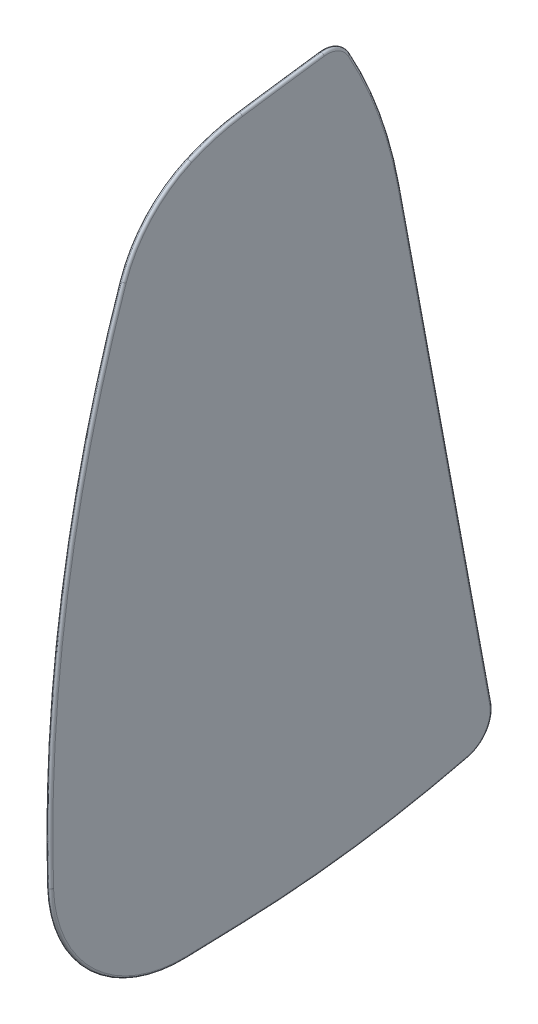
from build123d import *

# Parameters (mm, degrees)
BOSS_EXTRUDE1_DEPTH = 1.5875
FILLET1_R           = 0.79375


with BuildPart() as part:
    # Sketch1 → Boss-Extrude1 (new body)
    with BuildSketch(Plane(origin=(0, 0, 0), x_dir=(0, 0, -1), z_dir=(1, 0, 0))):
        with BuildLine():
            Line((-17.902635187, -0.569374423), (0, 0))
            ThreePointArc((0, 0), (37.12605167, 3.135689948), (73.719447715, 10.142802762))
            ThreePointArc((73.719447715, 10.142802762), (79.921895168, 14.569472776), (81.394996501, 22.045817758))
            Line((81.394996501, 22.045817758), (51.482359978, 183.08555927))
            ThreePointArc((51.482359978, 183.08555927), (45.228157216, 206.171293063), (35.33630552, 227.947826924))
            ThreePointArc((35.33630552, 227.947826924), (31.668987667, 231.46398016), (26.65826502, 232.303749395))
            ThreePointArc((26.65826502, 232.303749395), (13.324550439, 230.484854806), (0, 228.6))
            ThreePointArc((0, 228.6), (-8.544073084, 226.765963851), (-16.757921757, 223.783085471))
            ThreePointArc((-16.757921757, 223.783085471), (-30.073107103, 214.214239464), (-38.432839733, 200.108501446))
            ThreePointArc((-38.432839733, 200.108501446), (-57.504393579, 121.571137315), (-62.136879452, 40.884200297))
            ThreePointArc((-62.136879452, 40.884200297), (-48.597224699, 11.004576546), (-17.902635187, -0.569374423))
        make_face()
    extrude(amount=BOSS_EXTRUDE1_DEPTH)

    # Fillet1
    fillet1_edges = [part.edges().sort_by_distance(p)[0] for p in [
        (0, 226.765963851, 8.544073084),
        (0, 230.484854806, -13.324550439),
        (0, 231.46398016, -31.668987667),
        (0, 206.171293063, -45.228157216),
        (0, 102.565688514, -66.438678239),
        (0, 14.569472776, -79.921895168),
        (0, 3.135689948, -37.12605167),
        (0, -0.284687211, 8.951317593),
        (0, 11.004576546, 48.597224699),
        (0, 121.571137315, 57.504393579),
        (1.5875, 214.214239464, 30.073107103),
        (1.5875, 226.765963851, 8.544073084),
        (1.5875, 230.484854806, -13.324550439),
        (1.5875, 231.46398016, -31.668987667),
        (1.5875, 206.171293063, -45.228157216),
        (1.5875, 102.565688514, -66.438678239),
        (1.5875, 14.569472776, -79.921895168),
        (1.5875, 3.135689948, -37.12605167),
        (1.5875, -0.284687211, 8.951317593),
        (1.5875, 11.004576546, 48.597224699),
        (0, 214.214239464, 30.073107103),
        (1.5875, 121.571137315, 57.504393579),
    ]]
    fillet(fillet1_edges, radius=FILLET1_R - 0.0001)  # a hair under: the kernel refuses the full size


solid = part.part
